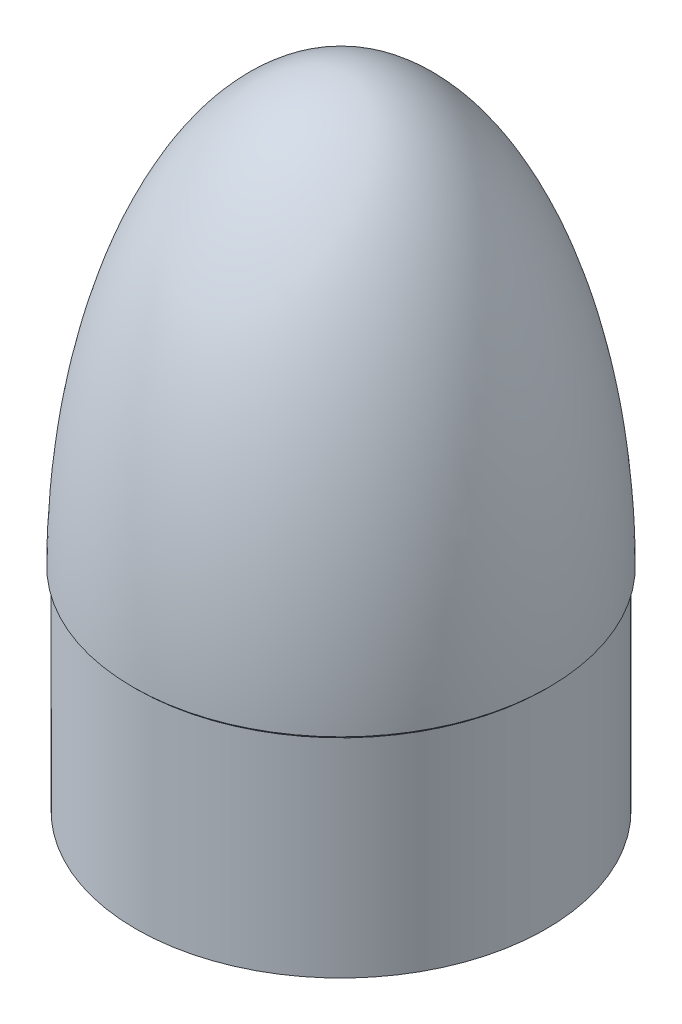
from build123d import *


with BuildPart() as part:
    # Sketch1 → Revolve1 (revolve)
    with BuildSketch(Plane.XY):
        with BuildLine():
            Line((0, 165.1), (0, 162.1028))
            add(Edge.make_bspline(
                [(76.3778, 0), (76.3778, 162.1028), (0, 162.1028)],
                knots=[4.71238898, 4.71238898, 4.71238898, 6.283185307, 6.283185307, 6.283185307], degree=2, weights=[1, 0.707106781, 1]))
            Line((76.3778, 0), (76.3778, -81.661))
            Line((76.3778, -81.661), (79.375, -81.661))
            Line((79.375, -81.661), (79.375, -1.143))
            Line((79.375, -1.143), (80.518, 0))
            add(Edge.make_bspline(
                [(80.518, 0), (80.518, 165.1), (0, 165.1)],
                knots=[1.570796327, 1.570796327, 1.570796327, 3.141592654, 3.141592654, 3.141592654], degree=2, weights=[1, 0.707106781, 1]))
        make_face()
    revolve(axis=Axis((0, 165.1, 0), (0, -1, 0)))


solid = part.part
